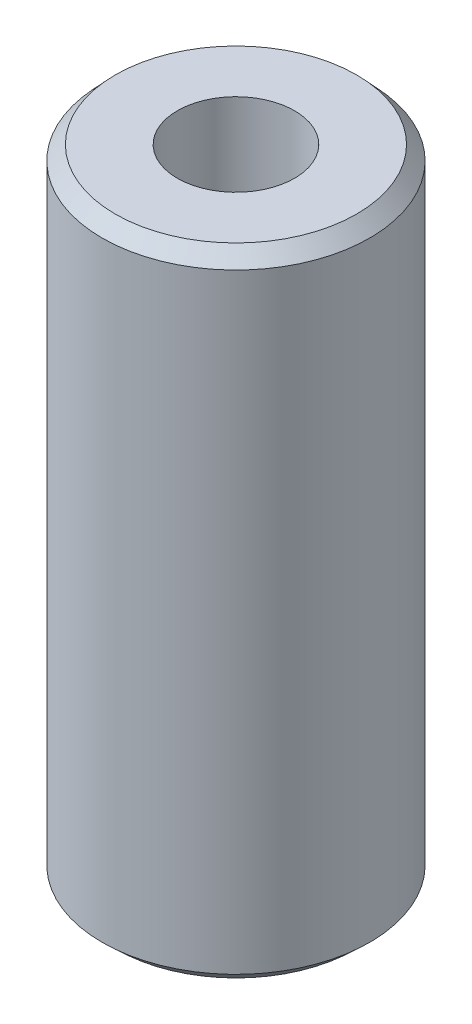
from build123d import *
from OCP.BRepFilletAPI import BRepFilletAPI_MakeChamfer

# Parameters (mm, degrees)
SKETCH1_R           = 22.5
BOSS_EXTRUDE1_DEPTH = 107.189800783
SKETCH2_R           = 9.854159693
CUT_EXTRUDE1_DEPTH  = 112.813028721
CHAMFER1_SIZE       = 2.383092828
CHAMFER1_SIZE2      = 2.211073845


with BuildPart() as part:
    # Sketch1 → Boss-Extrude1 (new body)
    with BuildSketch(Plane(origin=(0, 0, 0), x_dir=(1, 0, 0), z_dir=(0, 1, 0))):
        Circle(SKETCH1_R)
    extrude(amount=BOSS_EXTRUDE1_DEPTH)

    # Sketch2 → Cut-Extrude1 (cut, through all)
    with BuildSketch(Plane(origin=(0, 0, 0), x_dir=(1, 0, 0), z_dir=(0, 1, 0))):
        Circle(SKETCH2_R)
    extrude(amount=CUT_EXTRUDE1_DEPTH, mode=Mode.SUBTRACT)

    # Chamfer1: one chamfer whose edges measure the first distance from different faces: ONE call of the kernel's chamfer builder (chamfer() names one face for all edges)
    chamfer1_edges_1 = [part.edges().sort_by_distance(p)[0] for p in [
        (-22.5, 107.189800783, 0),
    ]]
    chamfer1_side_1 = [part.faces().sort_by_distance(p)[0] for p in [
        (-22.5, 53.594900391, 0),
    ]]
    chamfer1_edges_2 = [part.edges().sort_by_distance(p)[0] for p in [
        (-22.5, 0, 0),
    ]]
    chamfer1_side_2 = [part.faces().sort_by_distance(p)[0] for p in [
        (-21.863603897, 0, 0),
    ]]
    chamfer1 = BRepFilletAPI_MakeChamfer(part.part.solid().wrapped)
    for e in chamfer1_edges_1:
        chamfer1.Add(CHAMFER1_SIZE, CHAMFER1_SIZE2, e.wrapped, chamfer1_side_1[0].wrapped)  # the first distance lies on this face
    for e in chamfer1_edges_2:
        chamfer1.Add(CHAMFER1_SIZE, CHAMFER1_SIZE2, e.wrapped, chamfer1_side_2[0].wrapped)  # the first distance lies on this face
    add(Compound.cast(chamfer1.Shape()), mode=Mode.REPLACE)


solid = part.part
